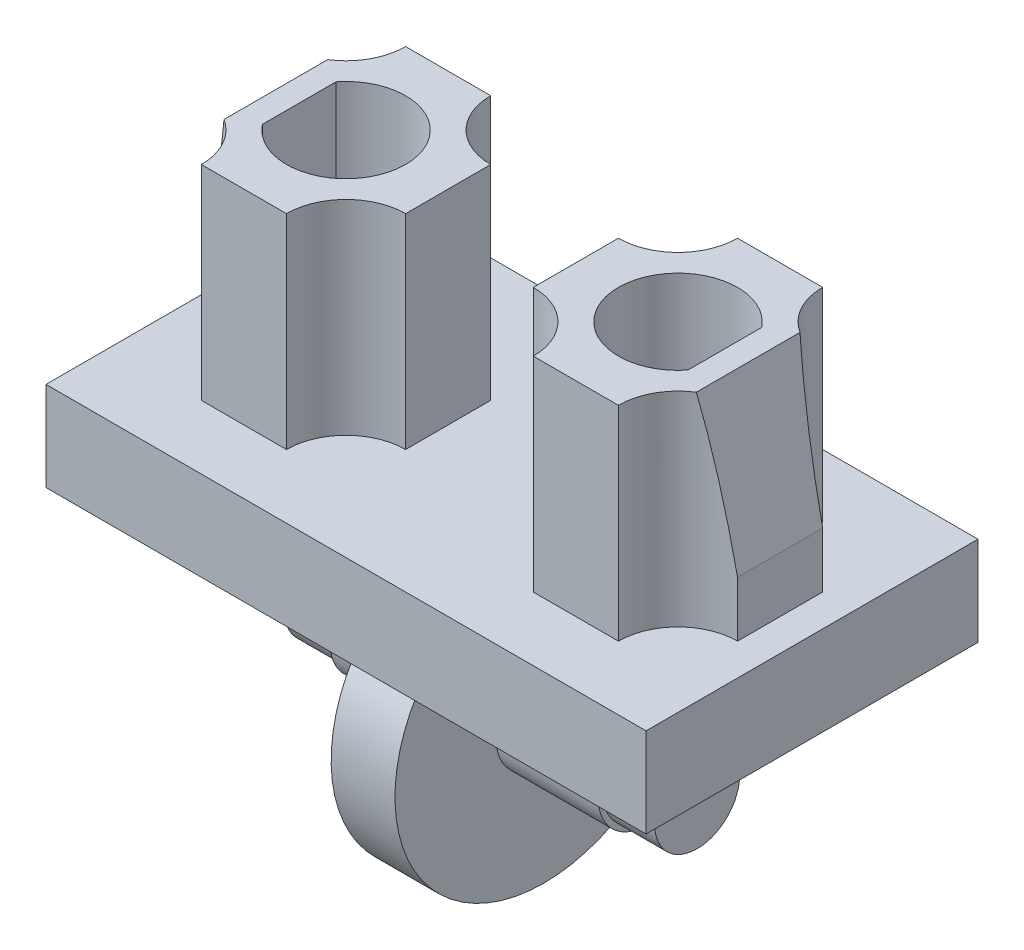
from build123d import *

# Parameters (mm, degrees)
SKETCH1_W           = 14.1
SKETCH1_H           = 7.8
BOSS_EXTRUDE3_DEPTH = 2.1
BOSS_EXTRUDE4_DEPTH = 4.8
CHAMFER1_START      = 6.87255411
CHAMFER1_OUTLINE_W  = 6
CHAMFER1_OUTLINE_H  = 6
CHAMFER1_DEPTH      = 2.12744589
CHAMFER2_START      = -9
CHAMFER2_OUTLINE_W  = 6
CHAMFER2_OUTLINE_H  = 6
CHAMFER2_DEPTH      = 2.12744589
SKETCH6_R           = 3.5
BOSS_EXTRUDE5_DEPTH = 0.75
SKETCH7_R           = 1.125
BOSS_EXTRUDE6_DEPTH = 2.4
BOSS_EXTRUDE7_START = 2.4
SKETCH9_R           = 1.125
BOSS_EXTRUDE7_DEPTH = 2.4
SKETCH10_R          = 1
BOSS_EXTRUDE8_DEPTH = 1.2
BOSS_EXTRUDE9_START = 1.2
SKETCH11_R          = 1
BOSS_EXTRUDE9_DEPTH = 1.2


with BuildPart() as part:
    # Sketch1 → Boss-Extrude3 (new body)
    with BuildSketch(Plane(origin=(0, 0, 0), x_dir=(1, 0, 0), z_dir=(0, 1, 0))):
        Rectangle(SKETCH1_W, SKETCH1_H)
    extrude(amount=BOSS_EXTRUDE3_DEPTH)

    # Sketch3 → Boss-Extrude4 (add)
    # profile 1 of 2: a face of its own
    with BuildSketch(Plane(origin=(0, 2.1, 0), x_dir=(1, 0, 0), z_dir=(0, 1, 0))):
        with BuildLine():
            Line((2.9, 2.4), (4.9, 2.4))
            ThreePointArc((4.9, 2.4), (5.310050506, 1.410050506), (6.3, 1))
            Line((6.3, 1), (6.3, -1))
            ThreePointArc((6.3, -1), (5.310050506, -1.410050506), (4.9, -2.4))
            Line((4.9, -2.4), (2.9, -2.4))
            ThreePointArc((2.9, -2.4), (2.489949494, -1.410050506), (1.5, -1))
            Line((1.5, -1), (1.5, 1))
            ThreePointArc((1.5, 1), (2.489949494, 1.410050506), (2.9, 2.4))
        make_face()
        with BuildLine():
            Line((5, 0.866025404), (5, -0.866025404))
            ThreePointArc((5, -0.866025404), (2.5, 0), (5, 0.866025404))
        make_face(mode=Mode.SUBTRACT)
    # profile 2 of 2: a face of its own
    with BuildSketch(Plane(origin=(0, 2.1, 0), x_dir=(1, 0, 0), z_dir=(0, 1, 0))):
        with BuildLine():
            Line((-6.3, 1), (-6.3, -1))
            ThreePointArc((-6.3, -1), (-5.310050506, -1.410050506), (-4.9, -2.4))
            Line((-4.9, -2.4), (-2.9, -2.4))
            ThreePointArc((-2.9, -2.4), (-2.489949494, -1.410050506), (-1.5, -1))
            Line((-1.5, -1), (-1.5, 1))
            ThreePointArc((-1.5, 1), (-2.489949494, 1.410050506), (-2.9, 2.4))
            Line((-2.9, 2.4), (-4.9, 2.4))
            ThreePointArc((-4.9, 2.4), (-5.310050506, 1.410050506), (-6.3, 1))
        make_face()
        with BuildLine():
            Line((-5, 0.866025404), (-5, -0.866025404))
            ThreePointArc((-5, -0.866025404), (-2.5, 0), (-5, 0.866025404))
        make_face(mode=Mode.SUBTRACT)
    extrude(amount=BOSS_EXTRUDE4_DEPTH)

    # Chamfer1: read off the stored shape, not the designer's step
    # Chamfer1 outline → Chamfer1 (cut)
    with BuildSketch(Plane(origin=(0, 0, 0), x_dir=(-0.20952908873087314, 0.9778024140774096, 0), z_dir=(0.9778024140774096, 0.20952908873087314, 0)).offset(CHAMFER1_START)):
        with Locations((4, 0)):
            Rectangle(CHAMFER1_OUTLINE_W, CHAMFER1_OUTLINE_H)
    extrude(amount=CHAMFER1_DEPTH, mode=Mode.SUBTRACT)

    # Chamfer2: read off the stored shape, not the designer's step
    # Chamfer2 outline → Chamfer2 (cut)
    with BuildSketch(Plane(origin=(0, 0, 0), x_dir=(0.20952908873087314, 0.9778024140774096, 0), z_dir=(0.9778024140774096, -0.20952908873087314, 0)).offset(CHAMFER2_START)):
        with Locations((4, 0)):
            Rectangle(CHAMFER2_OUTLINE_W, CHAMFER2_OUTLINE_H)
    extrude(amount=CHAMFER2_DEPTH, mode=Mode.SUBTRACT)

    # Sketch6 → Boss-Extrude5 (add, symmetric)
    with BuildSketch(Plane(origin=(0, 0, 0), x_dir=(0, 0, -1), z_dir=(1, 0, 0))):
        with Locations((0, -2.6)):
            Circle(SKETCH6_R)
    extrude(amount=BOSS_EXTRUDE5_DEPTH, both=True)

    # Sketch7 → Boss-Extrude6 (add)
    with BuildSketch(Plane(origin=(0.75, 0, 0), x_dir=(0, 0, -1), z_dir=(1, 0, 0))):
        with Locations((0, -2.6)):
            Circle(SKETCH7_R)
    extrude(amount=BOSS_EXTRUDE6_DEPTH)

    # Sketch9 → Boss-Extrude7 (add)
    with BuildSketch(Plane.ZY.offset(0.75).offset(BOSS_EXTRUDE7_START)):
        with Locations(Location((0, -2.6, 0), (0, 0, 180))):
            Circle(SKETCH9_R)
    extrude(amount=-BOSS_EXTRUDE7_DEPTH)

    # Sketch10 → Boss-Extrude8 (add)
    with BuildSketch(Plane.ZY.offset(3.15)):
        with Locations((0, -2.6)):
            Circle(SKETCH10_R)
    extrude(amount=BOSS_EXTRUDE8_DEPTH)

    # Sketch11 → Boss-Extrude9 (add)
    with BuildSketch(Plane(origin=(3.15, 0, 0), x_dir=(0, 0, -1), z_dir=(1, 0, 0)).offset(BOSS_EXTRUDE9_START)):
        with Locations(Location((0, -2.6, 0), (0, 0, 180))):
            Circle(SKETCH11_R)
    extrude(amount=-BOSS_EXTRUDE9_DEPTH)


solid = part.part
